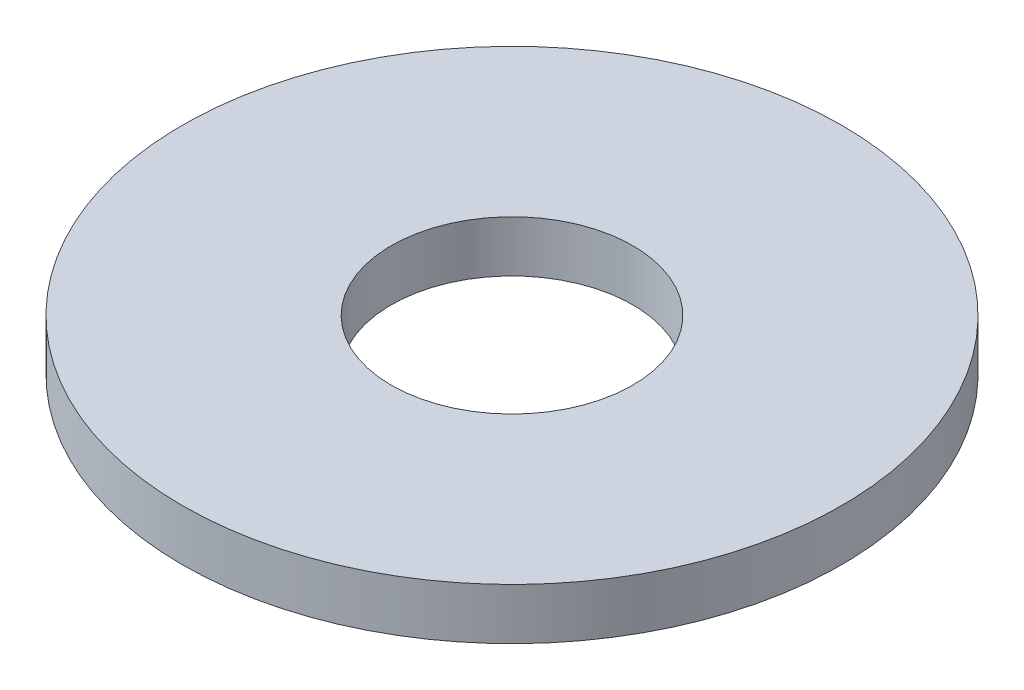
from build123d import *

# Parameters (mm, degrees)
SKETCH1_R           = 4.5
SKETCH1_R_2         = 1.65
BOSS_EXTRUDE1_DEPTH = 0.7


with BuildPart() as part:
    # Sketch1 → Boss-Extrude1 (new body)
    with BuildSketch(Plane(origin=(0, 0, 0), x_dir=(1, 0, 0), z_dir=(0, 1, 0))):
        Circle(SKETCH1_R)
        Circle(SKETCH1_R_2, mode=Mode.SUBTRACT)
    extrude(amount=BOSS_EXTRUDE1_DEPTH)


solid = part.part
